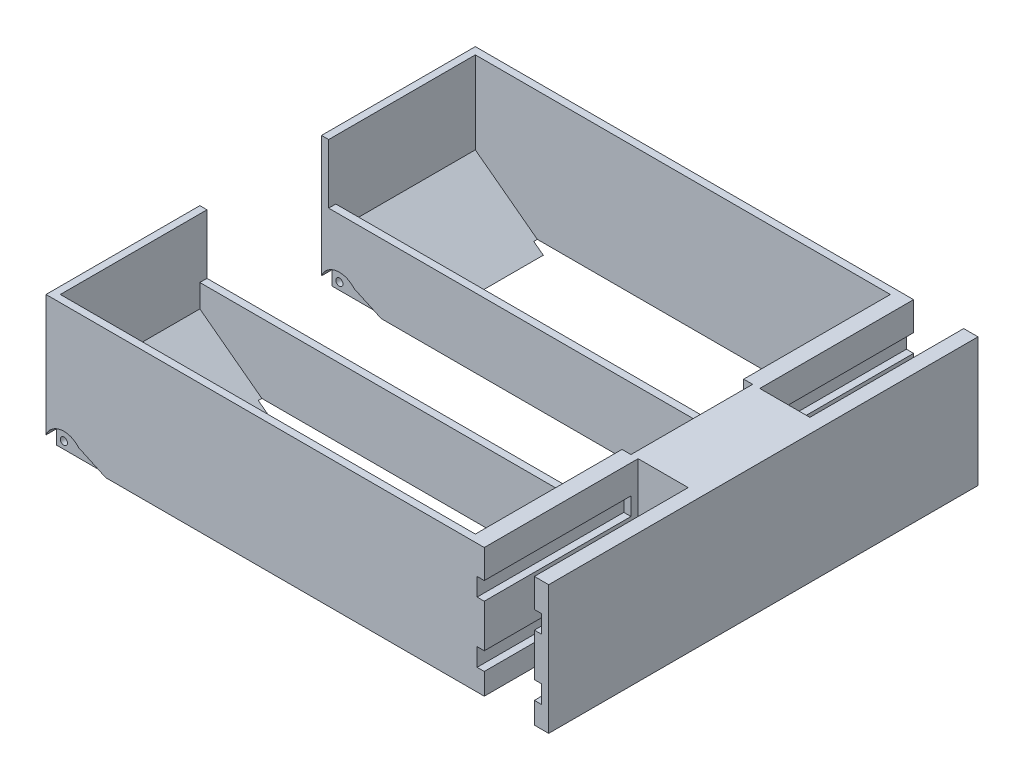
from build123d import *

# Parameters (mm, degrees)
SKETCH2_W            = 120
SKETCH2_H            = 43
BOSS_EXTRUDE1_DEPTH  = 38
SKETCH3_W            = 116
SKETCH3_H            = 39
CUT_EXTRUDE1_DEPTH   = 38
BOSS_EXTRUDE2_DEPTH  = 39
SKETCH5_W            = 43
SKETCH5_H            = 38
BOSS_EXTRUDE3_DEPTH  = 2.5
SKETCH6_W            = 2
SKETCH6_H            = 38
BOSS_EXTRUDE4_DEPTH  = 17
SKETCH7_W            = 34
SKETCH7_H            = 38
BOSS_EXTRUDE5_DEPTH  = 18
SKETCH8_W            = 4
SKETCH8_H            = 38
BOSS_EXTRUDE6_DEPTH  = 43
SKETCH9_W            = 18
SKETCH9_H            = 5
CUT_EXTRUDE2_DEPTH   = 41
SKETCH11_W           = 120
SKETCH11_H           = 2
CUT_EXTRUDE3_DEPTH   = 118.5
CUT_EXTRUDE4_DEPTH   = 3
MIRROR4_COPY_1_DEPTH = 3
CUT_EXTRUDE5_START   = -114
SKETCH13_R           = 1
CUT_EXTRUDE5_DEPTH   = 114
SKETCH14_W           = 116
SKETCH14_H           = 2
CUT_EXTRUDE6_DEPTH   = 16.6


with BuildPart() as part:
    # Sketch2 → Boss-Extrude1 (new body)
    with BuildSketch(Plane(origin=(0, 0, 0), x_dir=(1, 0, 0), z_dir=(0, 1, 0))):
        Rectangle(SKETCH2_W, SKETCH2_H)
    extrude(amount=BOSS_EXTRUDE1_DEPTH)

    # Sketch3 → Cut-Extrude1 (cut)
    with BuildSketch(Plane(origin=(0, 38, 0), x_dir=(1, 0, 0), z_dir=(0, 1, 0))):
        Rectangle(SKETCH3_W, SKETCH3_H)
    extrude(amount=-CUT_EXTRUDE1_DEPTH, mode=Mode.SUBTRACT)

    # Sketch4 → Boss-Extrude2 (add)
    with BuildSketch(Plane.XY.offset(-19.5)):
        Polygon((-58, 0), (-58, 15), (-38, 0), align=None)
    extrude(amount=BOSS_EXTRUDE2_DEPTH)

    # Sketch5 → Boss-Extrude3 (add)
    with BuildSketch(Plane(origin=(60, 0, 0), x_dir=(0, 0, -1), z_dir=(1, 0, 0))):
        with Locations((0, 19)):
            Rectangle(SKETCH5_W, SKETCH5_H)
    extrude(amount=BOSS_EXTRUDE3_DEPTH)

    # Sketch6 → Boss-Extrude4 (add)
    with BuildSketch(Plane(origin=(0, 0, -21.5), x_dir=(-1, 0, 0), z_dir=(0, 0, -1))):
        with Locations((-61.5, 19)):
            Rectangle(SKETCH6_W, SKETCH6_H)
    extrude(amount=BOSS_EXTRUDE4_DEPTH)

    # Mirror1: part across plane


with BuildPart() as part_1:
    add(part.part)
    add(part.part.mirror(Plane(origin=(0, 0, -38.5), x_dir=(1, 0, 0), z_dir=(0, 0, -1))))

    # Sketch7 → Boss-Extrude5 (add)
    with BuildSketch(Plane(origin=(62.5, 0, 0), x_dir=(0, 0, -1), z_dir=(1, 0, 0))):
        with Locations((38.5, 19)):
            Rectangle(SKETCH7_W, SKETCH7_H)
    extrude(amount=BOSS_EXTRUDE5_DEPTH)

    # Sketch8 → Boss-Extrude6 (add)
    with BuildSketch(Plane.XY.offset(-21.5)):
        with Locations((78.5, 19)):
            Rectangle(SKETCH8_W, SKETCH8_H)
    boss_extrude6 = extrude(amount=BOSS_EXTRUDE6_DEPTH)

    # Sketch9 → Cut-Extrude2 (cut)
    with BuildSketch(Plane.XY.offset(21.5)):
        with Locations((69.5, 27.5)):
            Rectangle(SKETCH9_W, SKETCH9_H)
        with Locations((69.5, 10.5)):
            Rectangle(SKETCH9_W, SKETCH9_H)
    cut_extrude2 = extrude(amount=-CUT_EXTRUDE2_DEPTH, mode=Mode.SUBTRACT)

    # Mirror2: Boss-Extrude6, Cut-Extrude2 across plane
    add(boss_extrude6.mirror(Plane(origin=(0, 0, -38.5), x_dir=(1, 0, 0), z_dir=(0, 0, -1))))
    add(cut_extrude2.mirror(Plane(origin=(0, 0, -38.5), x_dir=(1, 0, 0), z_dir=(0, 0, -1))), mode=Mode.SUBTRACT)

    # Sketch11 → Cut-Extrude3 (cut)
    with BuildSketch(Plane(origin=(80.5, 0, 0), x_dir=(0, 0, -1), z_dir=(1, 0, 0))):
        with Locations((38.5, 1)):
            Rectangle(SKETCH11_W, SKETCH11_H)
    extrude(amount=-CUT_EXTRUDE3_DEPTH, mode=Mode.SUBTRACT)

    # Sketch12 → Cut-Extrude4 (cut)
    with BuildSketch(Plane.XY.offset(21.5)):
        with BuildLine():
            Line((-38, 2), (-49.614835193, 2))
            ThreePointArc((-49.614835193, 2), (-56.018375168, 7.287996976), (-60, 0))
            Line((-60, 0), (-38, 0))
            Line((-38, 0), (-38, 2))
        make_face()
    cut_extrude4 = extrude(amount=-CUT_EXTRUDE4_DEPTH, mode=Mode.SUBTRACT)

    # Mirror3: Cut-Extrude4 across plane
    add(cut_extrude4.mirror(Plane.XY), mode=Mode.SUBTRACT)

    # Mirror4: Cut-Extrude4 across plane
    add(cut_extrude4.mirror(Plane(origin=(0, 0, -38.5), x_dir=(1, 0, 0), z_dir=(0, 0, -1))), mode=Mode.SUBTRACT)

    # Mirror4 copy 1 sketch → Mirror4 copy 1 (cut)
    with BuildSketch(Plane.XY.offset(-55.5)):
        with BuildLine():
            Line((-38, 2), (-49.614835193, 2))
            ThreePointArc((-49.614835193, 2), (-56.018375168, 7.287996976), (-60, 0))
            Line((-60, 0), (-38, 0))
            Line((-38, 0), (-38, 2))
        make_face()
    extrude(amount=-MIRROR4_COPY_1_DEPTH, mode=Mode.SUBTRACT)

    # Sketch13 → Cut-Extrude5 (cut)
    with BuildSketch(Plane.XY.offset(18.5).offset(CUT_EXTRUDE5_START)):
        with Locations((-58, 2)):
            Circle(SKETCH13_R)
    extrude(amount=CUT_EXTRUDE5_DEPTH, mode=Mode.SUBTRACT)

    # Chamfer1
    # the kernel refuses this chamfer: 10 mm, written as the material it takes off along each edge
    with BuildSketch(Plane(origin=(-49.614835193, 2, 38.180669666), x_dir=(-0.41152080336556635, 0.9114003666870882, 0), z_dir=(0, 0, -1))) as chamfer1_piece_1:
        with BuildLine():
            Line((4.024103798, 0), (-2.897424879, 6.010331734))
            Line((-2.897424879, 6.010331734), (-3.079704953, 5.928027573))
            ThreePointArc((-3.079704953, 5.928027573), (-1.554736759, 2.957293148), (-0.182280073, -0.082304161))
            Line((-0.182280073, -0.082304161), (0.082304161, -0.182280073))
            ThreePointArc((0.082304161, -0.182280073), (2.000716354, 0.27264804), (3.968173362, -0.192020276))
            Line((3.968173362, -0.192020276), (4.024103798, 0))
        make_face()
    extrude(amount=19.680669666, mode=Mode.SUBTRACT)

    # Chamfer2
    # the kernel refuses this chamfer: 10 mm, written as the material it takes off along each edge
    with BuildSketch(Plane(origin=(-49.614835193, 2, -38.180669666), x_dir=(0.9996854583228201, -0.0250795617564035, 0), z_dir=(0, 0, 1))) as chamfer2_piece_1:
        with BuildLine():
            Line((6.672267866, 0), (-1.747462586, 3.624884258))
            Line((-1.747462586, 3.624884258), (-1.896145364, 3.491117927))
            ThreePointArc((-1.896145364, 3.491117927), (-0.623209418, 1.920628258), (-0.199937092, -0.005015912))
            Line((-0.199937092, -0.005015912), (0.005015912, -0.199937092))
            ThreePointArc((0.005015912, -0.199937092), (3.339051469, -0.116294632), (6.677283779, -0.199937092))
            Line((6.677283779, -0.199937092), (6.672267866, 0))
        make_face()
    extrude(amount=19.680669666, mode=Mode.SUBTRACT)

    # Chamfer3
    # the kernel refuses this chamfer: 10 mm, written as the material it takes off along each edge
    with BuildSketch(Plane(origin=(-49.614835193, 2, -38.819330334), x_dir=(0.9996854583228201, -0.02507956175640344, 0), z_dir=(0, 0, -1))) as chamfer3_piece_1:
        with BuildLine():
            Line((6.672267866, 0), (-1.747462586, -3.624884258))
            Line((-1.747462586, -3.624884258), (-1.896145364, -3.491117927))
            ThreePointArc((-1.896145364, -3.491117927), (-0.623209418, -1.920628258), (-0.199937092, 0.005015912))
            Line((-0.199937092, 0.005015912), (0.005015912, 0.199937092))
            ThreePointArc((0.005015912, 0.199937092), (3.339051469, 0.116294632), (6.677283779, 0.199937092))
            Line((6.677283779, 0.199937092), (6.672267866, 0))
        make_face()
    extrude(amount=19.680669666, mode=Mode.SUBTRACT)

    # Chamfer4
    # the kernel refuses this chamfer: 10 mm, written as the material it takes off along each edge
    with BuildSketch(Plane(origin=(-49.614835193, 2, -115.180669666), x_dir=(0.9996854583228201, -0.0250795617564035, 0), z_dir=(0, 0, 1))) as chamfer4_piece_1:
        with BuildLine():
            Line((6.672267866, 0), (-1.747462586, 3.624884258))
            Line((-1.747462586, 3.624884258), (-1.896145364, 3.491117927))
            ThreePointArc((-1.896145364, 3.491117927), (-0.623209418, 1.920628258), (-0.199937092, -0.005015912))
            Line((-0.199937092, -0.005015912), (0.005015912, -0.199937092))
            ThreePointArc((0.005015912, -0.199937092), (3.339051469, -0.116294632), (6.677283779, -0.199937092))
            Line((6.677283779, -0.199937092), (6.672267866, 0))
        make_face()
    extrude(amount=19.680669666, mode=Mode.SUBTRACT)

    # Sketch14 → Cut-Extrude6 (cut)
    with BuildSketch(Plane(origin=(0, 38, 0), x_dir=(1, 0, 0), z_dir=(0, 1, 0))):
        with Locations((0, 20.5)):
            Rectangle(SKETCH14_W, SKETCH14_H)
    cut_extrude6 = extrude(amount=-CUT_EXTRUDE6_DEPTH, mode=Mode.SUBTRACT)

    # Mirror5: Cut-Extrude6 across plane
    add(cut_extrude6.mirror(Plane(origin=(0, 0, -38.5), x_dir=(1, 0, 0), z_dir=(0, 0, -1))), mode=Mode.SUBTRACT)


solid = part_1.part
